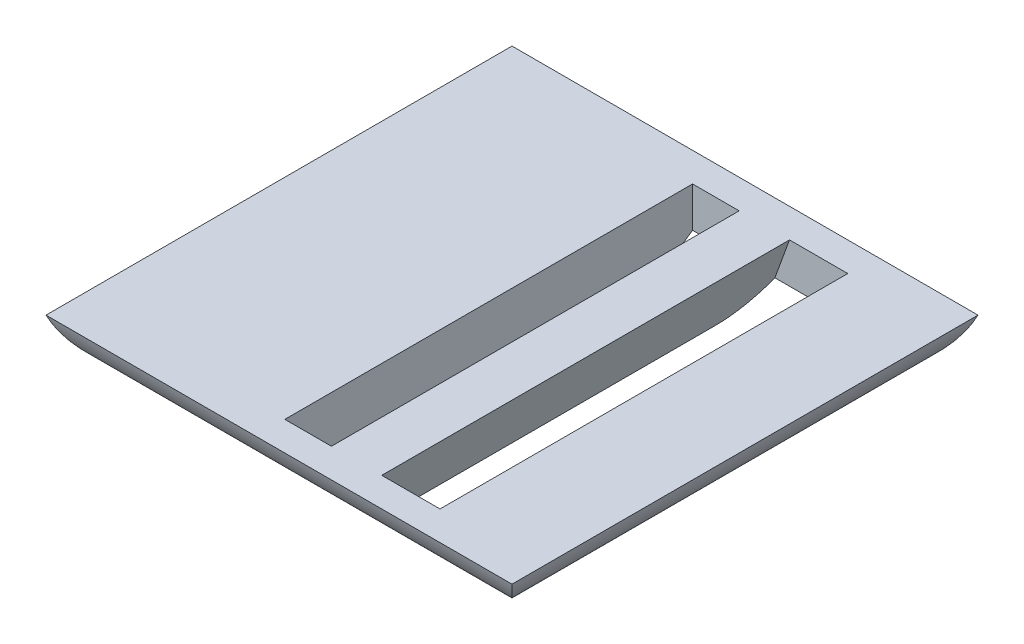
from build123d import *

# Parameters (mm, degrees)
SKETCH1_W           = 80
SKETCH1_H           = 80
BOSS_EXTRUDE1_DEPTH = 10
SKETCH2_W           = 8
SKETCH2_H           = 70
CUT_EXTRUDE1_DEPTH  = 20
CUT_EXTRUDE17_DEPTH = 75
BOSS_EXTRUDE2_DEPTH = 5
FILLET1_R           = 15


with BuildPart() as part:
    # Sketch1 → Boss-Extrude1 (new body)
    with BuildSketch(Plane(origin=(0, 0, 0), x_dir=(1, 0, 0), z_dir=(0, 1, 0))):
        Rectangle(SKETCH1_W, SKETCH1_H)
    extrude(amount=BOSS_EXTRUDE1_DEPTH)

    # Sketch2 → Cut-Extrude1 (cut)
    with BuildSketch(Plane.XZ):
        Rectangle(SKETCH2_W, SKETCH2_H)
    extrude(amount=-CUT_EXTRUDE1_DEPTH, mode=Mode.SUBTRACT)

    # Sketch8 → Cut-Extrude17 (cut)
    with BuildSketch(Plane(origin=(0, 0, -40), x_dir=(-1, 0, 0), z_dir=(0, 0, -1))):
        Polygon((-19, 0), (-22.639702343, 10), (-12.639702343, 10), (-9, 0), align=None)
    extrude(amount=-CUT_EXTRUDE17_DEPTH, mode=Mode.SUBTRACT)

    # Sketch10 → Boss-Extrude2 (add)
    with BuildSketch(Plane(origin=(0, 0, -40), x_dir=(-1, 0, 0), z_dir=(0, 0, -1))):
        Polygon((-9, 0), (-12.639702343, 10), (-22.639702343, 10), (-19, 0), align=None)
    extrude(amount=-BOSS_EXTRUDE2_DEPTH)

    # Fillet1
    # the kernel refuses this fillet: 15 mm, written as the material it takes off along each edge
    with BuildSketch(Plane(origin=(-40, 0, 75.355339059), x_dir=(1, 0, 0), z_dir=(0, 0, -1)), Plane(origin=(40, 0, -75.355339059), x_dir=(-1, 0, 0), z_dir=(0, 0, 1))) as fillet1_piece_1:
        with BuildLine():
            CenterArc((14.142135624, -15), FILLET1_R, 90, 70.528779366)
            Line((0, -10), (-0.282842712, -9.9))
            ThreePointArc((-0.282842712, -9.9), (-0.3, -5), (-0.3, 0))
            Line((-0.3, 0), (0, 0.3))
            Line((0, 0.3), (14.142135624, 0.3))
            Line((14.142135624, 0.3), (14.142135624, 0))
        make_face()
    extrude(amount=150.710678119, mode=Mode.SUBTRACT)
    with BuildSketch(Plane(origin=(-75.355339059, 0, -40), x_dir=(0, 1, 0), z_dir=(1, 0, 0)), Plane(origin=(75.355339059, 0, 40), x_dir=(0, 1, 0), z_dir=(-1, 0, 0))) as fillet1_piece_2:
        with BuildLine():
            CenterArc((15, 14.142135624), FILLET1_R, 180, 70.528779366)
            Line((0, 14.142135624), (-0.3, 14.142135624))
            Line((-0.3, 14.142135624), (-0.3, 0))
            Line((-0.3, 0), (0, -0.3))
            ThreePointArc((0, -0.3), (5, -0.3), (9.9, -0.282842712))
            Line((9.9, -0.282842712), (10, 0))
        make_face()
    extrude(amount=150.710678119, mode=Mode.SUBTRACT)


solid = part.part
